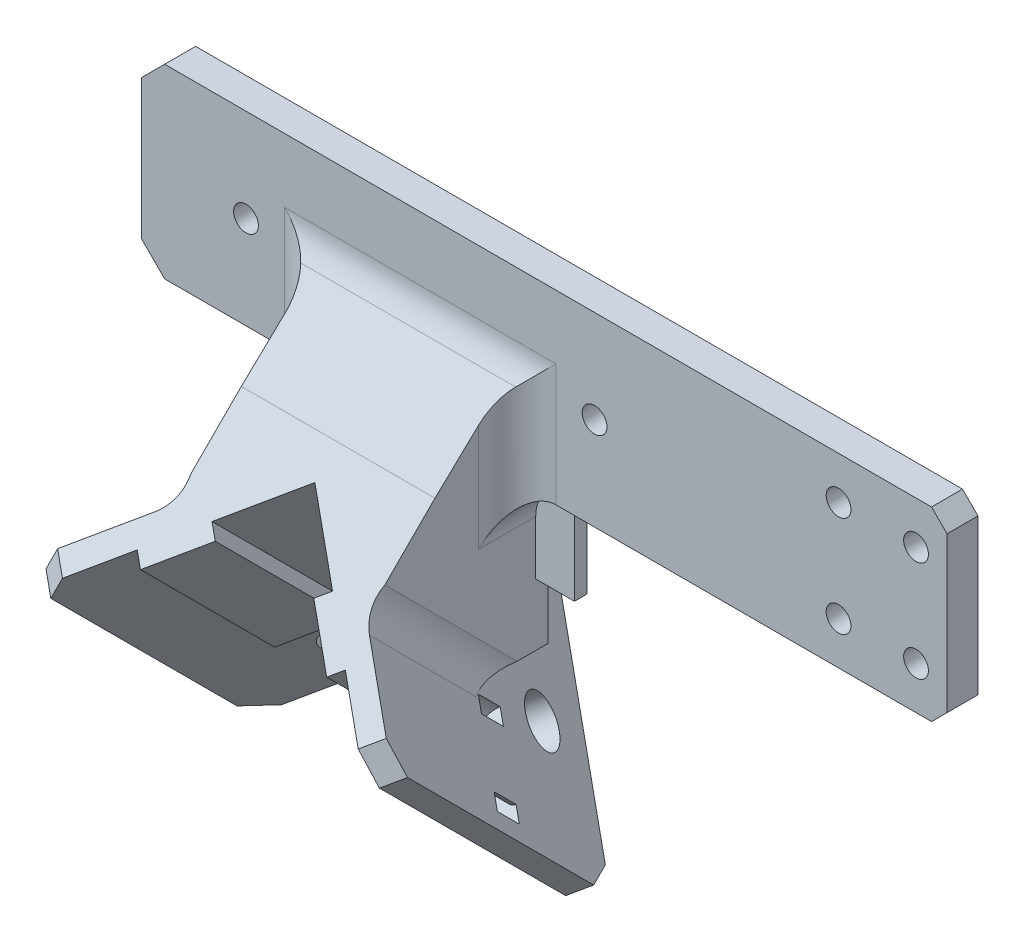
from build123d import *

# Parameters (mm, degrees)
CROQUIS1_R                   = 1.6
SALIENTE_EXTRUIR1_DEPTH      = 4
CROQUIS3_R                   = 1.6
SALIENTE_EXTRUIR3_DEPTH      = 4
SALIENTE_EXTRUIR4_DEPTH      = 10
SALIENTE_EXTRUIR4_DEPTH_BACK = 30
CORTAR_EXTRUIR8_REACH        = 97.414
CROQUIS13_R                  = 3.1
CORTAR_EXTRUIR9_DEPTH        = 2
CORTAR_EXTRUIR10_REACH       = 83.858
CROQUIS15_R                  = 3.1
CORTAR_EXTRUIR11_DEPTH       = 2
SALIENTE_EXTRUIR5_DEPTH      = 12.5
CORTAR_EXTRUIR12_DEPTH       = 95.018496218
REDONDEO1_R                  = 5
CHAFL_N1_SIZE                = 3
CROQUIS20_W                  = 35
CROQUIS20_H                  = 12
SALIENTE_EXTRUIR6_DEPTH      = 1.6
CORTAR_EXTRUIR13_START       = -16
CORTAR_EXTRUIR13_DEPTH       = 4


with BuildPart() as part:
    # Croquis1 → Saliente-Extruir1 (new body)
    with BuildSketch(Plane.XY):
        Polygon((12.5, -12), (36, -12), (36, 12), (-36, 12), (-36, -12), (-12.5, -12), (-12.5, -32), (12.5, -32), align=None)
        with Locations((-22.5, 0)):
            Circle(CROQUIS1_R, mode=Mode.SUBTRACT)
        with Locations(Location((22.5, 0, 0), (0, 0, 180))):
            Circle(CROQUIS1_R, mode=Mode.SUBTRACT)
    extrude(amount=SALIENTE_EXTRUIR1_DEPTH)

    # Croquis3 → Saliente-Extruir3 (add)
    with BuildSketch(Plane(origin=(0, 0, 0), x_dir=(-1, 0, 0), z_dir=(0, 0, -1))):
        Polygon((-66, 12), (-36, 12), (-36, -12), (-66, -12), (-68, -10), (-68, 10), align=None)
        with Locations((-54, 6.5)):
            Circle(CROQUIS3_R, mode=Mode.SUBTRACT)
        with Locations((-64, 6.5)):
            Circle(CROQUIS3_R, mode=Mode.SUBTRACT)
        with Locations(Location((-54, -6.5, 0), (0, 0, 180))):
            Circle(CROQUIS3_R, mode=Mode.SUBTRACT)
        with Locations(Location((-64, -6.5, 0), (0, 0, 180))):
            Circle(CROQUIS3_R, mode=Mode.SUBTRACT)
    extrude(amount=-SALIENTE_EXTRUIR3_DEPTH)

    # Croquis5 → Saliente-Extruir4 (add, two sides: drawn at the far end of the back side and taken through both)
    with BuildSketch(Plane(origin=(0, -4.201010127, -3.798989873), x_dir=(1, 0, 0), z_dir=(0, 0.7071067811865438, 0.7071067811865512)).offset(-SALIENTE_EXTRUIR4_DEPTH_BACK)):
        Polygon((-13.435028843, -33.707106781), (-21.213203436, -41.485281374), (-23.334523779, -39.363961031), (0, -16.029437252), (23.334523779, -39.363961031), (21.213203436, -41.485281374), (13.435028843, -33.707106781), (12.02081528, -35.121320344), (6.363961031, -29.464466094), (7.778174593, -28.050252532), (0, -20.272077939), (-7.778174593, -28.050252532), (-6.363961031, -29.464466094), (-12.02081528, -35.121320344), align=None)
    extrude(amount=SALIENTE_EXTRUIR4_DEPTH + SALIENTE_EXTRUIR4_DEPTH_BACK)

    # Croquis13 → Cortar-Extruir8 (cut, up to next)
    with BuildSketch(Plane(origin=(-11.692388155, -8.267766953, 8.267766953), x_dir=(0.40824829046385985, 0.2886751345948103, 0.866025403784441), z_dir=(-0.7071067811865496, -0.5000000000000013, 0.4999999999999959)), mode=Mode.PRIVATE) as cortar_extruir8_sk1:
        with Locations(Location((-5.529378483, -40.083354696, 0), (0, 0, 270))):
            Circle(CROQUIS13_R)
    cortar_extruir8_tool1 = extrude(cortar_extruir8_sk1.sketch, amount=-CORTAR_EXTRUIR8_REACH, mode=Mode.PRIVATE) & part.part
    add(cortar_extruir8_tool1.solids().sort_by_distance((9.192388, -42.591883, 3.479185))[0], mode=Mode.SUBTRACT)

    # Croquis14 → Cortar-Extruir9 (cut)
    with BuildSketch(Plane(origin=(-11.692388155, -8.267766953, 8.267766953), x_dir=(0.40824829046385985, 0.2886751345948103, 0.866025403784441), z_dir=(-0.7071067811865496, -0.5000000000000013, 0.4999999999999959))):
        Polygon((-11.513014174, -39.415444584), (-6.89421202, -45.947417231), (0.454257208, -40.751264808), (-4.164544945, -34.219292161), align=None)
    extrude(amount=-CORTAR_EXTRUIR9_DEPTH, mode=Mode.SUBTRACT)

    # Croquis15 → Cortar-Extruir10 (cut, up to next)
    with BuildSketch(Plane(origin=(8.62825877, -6.101100286, 14.767766953), x_dir=(0.6666666666666553, 0.23570226039552375, -0.7071067811865557), z_dir=(0.7071067811865587, -0.49999999999999484, 0.4999999999999895)), mode=Mode.PRIVATE) as cortar_extruir10_sk1:
        with Locations(Location((-12.499158228, -40.25364355, 0), (0, 0, 54.735610317))):
            Circle(CROQUIS15_R)
    cortar_extruir10_tool1 = extrude(cortar_extruir10_sk1.sketch, amount=-CORTAR_EXTRUIR10_REACH, mode=Mode.PRIVATE) & part.part
    add(cortar_extruir10_tool1.solids().sort_by_distance((-9.192388, -42.591883, 3.479185))[0], mode=Mode.SUBTRACT)

    # Croquis17 → Cortar-Extruir11 (cut)
    with BuildSketch(Plane(origin=(8.62825877, -6.101100286, 14.767766953), x_dir=(0.6666666666666595, 0.2357022603955385, -0.7071067811865467), z_dir=(0.7071067811865586, -0.4999999999999948, 0.49999999999998956))):
        Polygon((-14.770394394, -45.829617571), (-7.227922061, -43.162950904), (-10.227922061, -34.67766953), (-17.770394394, -37.344336196), align=None)
    extrude(amount=-CORTAR_EXTRUIR11_DEPTH, mode=Mode.SUBTRACT)

    # Croquis19 → Saliente-Extruir5 (add, symmetric)
    with BuildSketch(Plane(origin=(0, 0, 0), x_dir=(0, 0, -1), z_dir=(1, 0, 0))):
        Polygon((-14.606601718, -8.464466094), (-21.071067812, -14.928932188), (-4, -32), (-4, 1.6), align=None)
    extrude(amount=SALIENTE_EXTRUIR5_DEPTH, both=True)

    # Croquis18 → Cortar-Extruir12 (cut, through all)
    with BuildSketch(Plane(origin=(0, 3.071067812, 3.071067812), x_dir=(1, 0, 0), z_dir=(0, 0.7071067811865438, 0.7071067811865513))):
        Polygon((0, -20.556349186), (4.899494937, -25.455844123), (-4.899494937, -25.455844123), align=None)
    extrude(amount=-CORTAR_EXTRUIR12_DEPTH, mode=Mode.SUBTRACT)

    # Redondeo1
    # the kernel refuses this fillet: 5 mm, written as the material it adds along each edge
    with BuildSketch(Plane(origin=(12.5, -12, 4), x_dir=(1, 0, 0), z_dir=(0, 1, 0))) as redondeo1_piece_1_section:
        with BuildLine():
            CenterArc((REDONDEO1_R, -REDONDEO1_R), REDONDEO1_R, 90, 90)
            Line((0, -REDONDEO1_R), (0, 0))
            Line((0, 0), (REDONDEO1_R, 0))
        make_face()
    redondeo1_piece_1 = extrude(amount=26.1, mode=Mode.PRIVATE)
    redondeo1_piece_1 = split(redondeo1_piece_1, bisect_by=Plane(origin=(12.5, -4.843560917, 10.790651749), z_dir=(0, -0.7254024787176051, -0.6883249551413595)), keep=Keep.TOP, mode=Mode.PRIVATE)
    add(redondeo1_piece_1)
    with BuildSketch(Plane(origin=(-12.5, -12, 4), x_dir=(0, 0, 1), z_dir=(0, 1, 0))) as redondeo1_piece_2_section:
        with BuildLine():
            CenterArc((REDONDEO1_R, -REDONDEO1_R), REDONDEO1_R, 90, 90)
            Line((0, -REDONDEO1_R), (0, 0))
            Line((0, 0), (REDONDEO1_R, 0))
        make_face()
    redondeo1_piece_2 = extrude(amount=26.1, mode=Mode.PRIVATE)
    redondeo1_piece_2 = split(redondeo1_piece_2, bisect_by=Plane(origin=(-12.5, -4.843560917, 10.790651749), z_dir=(0, -0.7254024787176051, -0.6883249551413595)), keep=Keep.TOP, mode=Mode.PRIVATE)
    add(redondeo1_piece_2)
    with BuildSketch(Plane(origin=(9.142135624, -14.928932188, 21.071067812), x_dir=(1, 0, 0), z_dir=(5.181305113656439e-15, -0.7071067811865475, -0.7071067811865476))) as redondeo1_piece_3_section:
        with BuildLine():
            CenterArc((8.223291456, 1.152223645), REDONDEO1_R, 135, 58.323256203)
            Line((4.687757551, 4.687757551), (0, 0))
            Line((0, 0), (3.357864376, 0))
        make_face()
    redondeo1_piece_3 = extrude(amount=40.715861386, mode=Mode.PRIVATE)
    redondeo1_piece_3 = split(redondeo1_piece_3, bisect_by=Plane(origin=(9.142135624, -32, 21.071067812), z_dir=(0, 1, 0)), keep=Keep.TOP, mode=Mode.PRIVATE)
    add(redondeo1_piece_3)
    with BuildSketch(Plane(origin=(-9.142135624, -43.719393876, -7.719393876), x_dir=(-1, 0, 0), z_dir=(5.181305113656437e-15, 0.7071067811865476, 0.7071067811865476))) as redondeo1_piece_4_section:
        with BuildLine():
            CenterArc((8.223291456, 1.152223645), REDONDEO1_R, 135, 58.323256203)
            Line((4.687757551, 4.687757551), (0, 0))
            Line((0, 0), (3.357864376, 0))
        make_face()
    redondeo1_piece_4 = extrude(amount=40.715861386, mode=Mode.PRIVATE)
    redondeo1_piece_4 = split(redondeo1_piece_4, bisect_by=Plane(origin=(-9.142135624, -32, -7.719393876), z_dir=(0, 1, 0)), keep=Keep.TOP, mode=Mode.PRIVATE)
    add(redondeo1_piece_4)
    with BuildSketch(Plane(origin=(-12.5, -12, 0), x_dir=(-1, 0, 0), z_dir=(0, 0, 1))) as redondeo1_piece_5:
        with BuildLine():
            CenterArc((REDONDEO1_R, REDONDEO1_R), REDONDEO1_R, 180, 90)
            Line((0, REDONDEO1_R), (0, 0))
            Line((0, 0), (REDONDEO1_R, 0))
        make_face()
    extrude(amount=4)
    with BuildSketch(Plane(origin=(12.5, -12, 0), x_dir=(1, 0, 0), z_dir=(0, 0, 1))) as redondeo1_piece_6:
        with BuildLine():
            CenterArc((REDONDEO1_R, -REDONDEO1_R), REDONDEO1_R, 90, 90)
            Line((0, -REDONDEO1_R), (0, 0))
            Line((0, 0), (REDONDEO1_R, 0))
        make_face()
    extrude(amount=4)
    with BuildSketch(Plane(origin=(12.5, 1.6, 4), x_dir=(0, -0.6883249551413598, 0.725402478717605), z_dir=(-1, 0, 0))) as redondeo1_piece_7:
        with BuildLine():
            CenterArc((REDONDEO1_R * 0.429658091891, REDONDEO1_R), REDONDEO1_R, 223.497660381, 46.502339619)
            Line((-REDONDEO1_R * 0.295744386827, REDONDEO1_R * 0.311675044859), (0, 0))
            Line((0, 0), (REDONDEO1_R * 0.429658091891, 0))
        make_face()
    extrude(amount=25)
    with BuildSketch(Plane(origin=(12.5, -12, 0), x_dir=(1, 0, 0), z_dir=(0, 0, 1))) as redondeo1_piece_8a_section:
        with BuildLine():
            CenterArc((REDONDEO1_R, -REDONDEO1_R), REDONDEO1_R, 90, 90)
            Line((0, -REDONDEO1_R), (0, 0))
            Line((0, 0), (REDONDEO1_R, 0))
        make_face()
    redondeo1_piece_8a = extrude(amount=16.5, mode=Mode.PRIVATE)
    redondeo1_piece_8a = split(redondeo1_piece_8a, bisect_by=Plane(origin=(12.5, -12, 4), z_dir=(0, 0, 1)), keep=Keep.TOP, mode=Mode.PRIVATE)
    with BuildSketch(Plane(origin=(12.5, -24.5, 4), x_dir=(1, 0, 0), z_dir=(0, 1, 0))) as redondeo1_piece_8b_section:
        with BuildLine():
            CenterArc((REDONDEO1_R, -REDONDEO1_R), REDONDEO1_R, 90, 90)
            Line((0, -REDONDEO1_R), (0, 0))
            Line((0, 0), (REDONDEO1_R, 0))
        make_face()
    redondeo1_piece_8b = extrude(amount=38.6, mode=Mode.PRIVATE)
    redondeo1_piece_8b = split(redondeo1_piece_8b, bisect_by=Plane(origin=(12.5, -12, 4), z_dir=(0, -1, 0)), keep=Keep.TOP, mode=Mode.PRIVATE)
    redondeo1_piece_8 = redondeo1_piece_8a & redondeo1_piece_8b
    add(redondeo1_piece_8)
    with BuildSketch(Plane(origin=(17.870726149, 1.6, 4), x_dir=(0, -0.6883249551413598, 0.725402478717605), z_dir=(-1, 0, 0))) as redondeo1_piece_9a_section:
        with BuildLine():
            CenterArc((REDONDEO1_R * 0.429658091891, REDONDEO1_R), REDONDEO1_R, 223.497660381, 46.502339619)
            Line((-REDONDEO1_R * 0.295744386827, REDONDEO1_R * 0.311675044859), (0, 0))
            Line((0, 0), (REDONDEO1_R * 0.429658091891, 0))
        make_face()
    redondeo1_piece_9a = extrude(amount=30.370726149, mode=Mode.PRIVATE)
    redondeo1_piece_9a = split(redondeo1_piece_9a, bisect_by=Plane(origin=(12.5, 1.6, 4), z_dir=(1, 0, 0)), keep=Keep.TOP, mode=Mode.PRIVATE)
    with BuildSketch(Plane(origin=(12.5, -12, 4), x_dir=(1, 0, 0), z_dir=(0, 1, 0))) as redondeo1_piece_9b_section:
        with BuildLine():
            CenterArc((REDONDEO1_R, -REDONDEO1_R), REDONDEO1_R, 90, 90)
            Line((0, -REDONDEO1_R), (0, 0))
            Line((0, 0), (REDONDEO1_R, 0))
        make_face()
    redondeo1_piece_9b = extrude(amount=26.1, mode=Mode.PRIVATE)
    redondeo1_piece_9b = split(redondeo1_piece_9b, bisect_by=Plane(origin=(12.5, 12, 4), z_dir=(0, -1, 0)), keep=Keep.TOP, mode=Mode.PRIVATE)
    redondeo1_piece_9b = split(redondeo1_piece_9b, bisect_by=Plane(origin=(12.5, -4.843560917, 10.790651749), z_dir=(0, 0.7254024787176051, 0.6883249551413595)), keep=Keep.TOP, mode=Mode.PRIVATE)
    redondeo1_piece_9 = redondeo1_piece_9a & redondeo1_piece_9b
    add(redondeo1_piece_9)
    with BuildSketch(Plane(origin=(-12.5, -12, 0), x_dir=(-1, 0, 0), z_dir=(0, 0, 1))) as redondeo1_piece_10a_section:
        with BuildLine():
            CenterArc((REDONDEO1_R, REDONDEO1_R), REDONDEO1_R, 180, 90)
            Line((0, REDONDEO1_R), (0, 0))
            Line((0, 0), (REDONDEO1_R, 0))
        make_face()
    redondeo1_piece_10a = extrude(amount=16.5, mode=Mode.PRIVATE)
    redondeo1_piece_10a = split(redondeo1_piece_10a, bisect_by=Plane(origin=(-12.5, -12, 4), z_dir=(0, 0, 1)), keep=Keep.TOP, mode=Mode.PRIVATE)
    with BuildSketch(Plane(origin=(-12.5, -24.5, 4), x_dir=(0, 0, 1), z_dir=(0, 1, 0))) as redondeo1_piece_10b_section:
        with BuildLine():
            CenterArc((REDONDEO1_R, -REDONDEO1_R), REDONDEO1_R, 90, 90)
            Line((0, -REDONDEO1_R), (0, 0))
            Line((0, 0), (REDONDEO1_R, 0))
        make_face()
    redondeo1_piece_10b = extrude(amount=38.6, mode=Mode.PRIVATE)
    redondeo1_piece_10b = split(redondeo1_piece_10b, bisect_by=Plane(origin=(-12.5, -12, 4), z_dir=(0, -1, 0)), keep=Keep.TOP, mode=Mode.PRIVATE)
    redondeo1_piece_10 = redondeo1_piece_10a & redondeo1_piece_10b
    add(redondeo1_piece_10)
    with BuildSketch(Plane(origin=(-12.5, -12, 4), x_dir=(0, 0, 1), z_dir=(0, 1, 0))) as redondeo1_piece_11a_section:
        with BuildLine():
            CenterArc((REDONDEO1_R, -REDONDEO1_R), REDONDEO1_R, 90, 90)
            Line((0, -REDONDEO1_R), (0, 0))
            Line((0, 0), (REDONDEO1_R, 0))
        make_face()
    redondeo1_piece_11a = extrude(amount=26.1, mode=Mode.PRIVATE)
    redondeo1_piece_11a = split(redondeo1_piece_11a, bisect_by=Plane(origin=(-12.5, 12, 4), z_dir=(0, -1, 0)), keep=Keep.TOP, mode=Mode.PRIVATE)
    redondeo1_piece_11a = split(redondeo1_piece_11a, bisect_by=Plane(origin=(-12.5, -4.843560917, 10.790651749), z_dir=(0, 0.7254024787176051, 0.6883249551413595)), keep=Keep.TOP, mode=Mode.PRIVATE)
    with BuildSketch(Plane(origin=(12.5, 1.6, 4), x_dir=(0, -0.6883249551413598, 0.725402478717605), z_dir=(-1, 0, 0))) as redondeo1_piece_11b_section:
        with BuildLine():
            CenterArc((REDONDEO1_R * 0.429658091891, REDONDEO1_R), REDONDEO1_R, 223.497660381, 46.502339619)
            Line((-REDONDEO1_R * 0.295744386827, REDONDEO1_R * 0.311675044859), (0, 0))
            Line((0, 0), (REDONDEO1_R * 0.429658091891, 0))
        make_face()
    redondeo1_piece_11b = extrude(amount=30.370726149, mode=Mode.PRIVATE)
    redondeo1_piece_11b = split(redondeo1_piece_11b, bisect_by=Plane(origin=(-12.5, 1.6, 4), z_dir=(-1, 0, 0)), keep=Keep.TOP, mode=Mode.PRIVATE)
    redondeo1_piece_11 = redondeo1_piece_11a & redondeo1_piece_11b
    add(redondeo1_piece_11)

    # Chaflán1
    # the kernel refuses this chamfer: 3 mm, written as the material it takes off along each edge
    with BuildSketch(Plane(origin=(28.789887219, -49.39121286, -1.035194012), x_dir=(-0.7071067811865446, 0.500000000000004, -0.5000000000000001), z_dir=(-0.7071067811865506, -0.5000000000000006, 0.4999999999999953))) as chafl_n1_piece_1:
        Polygon((CHAFL_N1_SIZE, 0), (0, -CHAFL_N1_SIZE), (0, 0), align=None)
    extrude(amount=18.430097928, mode=Mode.SUBTRACT)
    with BuildSketch(Plane(origin=(28.789887219, -21.106941612, 27.249077236), x_dir=(-0.7071067811865446, 0.5000000000000879, -0.49999999999991623), z_dir=(-0.7071067811865506, -0.5000000000000006, 0.4999999999999953)), Plane(origin=(-15.757839996, -58.606261823, 8.179854952), x_dir=(0, 0.707106781186544, 0.7071067811865511), z_dir=(-0.7071067811865535, 0.4999999999999984, -0.49999999999999317)), Plane(origin=(-15.757839996, -30.321990576, 36.4641262), x_dir=(0.7071067811865416, 0.50000000000009, -0.49999999999991834), z_dir=(-0.7071067811865535, 0.4999999999999984, -0.49999999999999317))) as chafl_n1_piece_2:
        Polygon((CHAFL_N1_SIZE, 0), (0, CHAFL_N1_SIZE), (0, 0), align=None)
    extrude(amount=18.430097928, mode=Mode.SUBTRACT)
    with BuildSketch(Plane(origin=(-36, -12, -7.715048964), x_dir=(0, 1, 0), z_dir=(0, 0, 1)), Plane(origin=(-36, 12, -7.715048964), x_dir=(1, 0, 0), z_dir=(0, 0, 1))) as chafl_n1_piece_3:
        Polygon((CHAFL_N1_SIZE, 0), (0, -CHAFL_N1_SIZE), (0, 0), align=None)
    extrude(amount=19.430097928, mode=Mode.SUBTRACT)
    with BuildSketch(Plane(origin=(17.47617872, -45.267427059, 12.518689717), x_dir=(0.7071067811865496, 0.5000000000000003, -0.49999999999999684), z_dir=(-0.7071067811865456, 0.5000000000000039, -0.49999999999999906))) as chafl_n1_piece_4_section:
        Polygon((CHAFL_N1_SIZE, 0), (0, -CHAFL_N1_SIZE), (0, 0), align=None)
    chafl_n1_piece_4 = extrude(amount=23.430097928, mode=Mode.PRIVATE)
    chafl_n1_piece_4 = split(chafl_n1_piece_4, bisect_by=Plane(origin=(18.890392282, -44.267427059, 11.518689717), z_dir=(-0.7071067811865606, -0.49999999999999345, 0.4999999999999882)), keep=Keep.TOP, mode=Mode.PRIVATE)
    add(chafl_n1_piece_4, mode=Mode.SUBTRACT)
    with BuildSketch(Plane(origin=(-0.908597591, -33.552378095, 0.803640753), x_dir=(-0.7071067811865586, 0.49999999999999445, -0.49999999999999), z_dir=(-0.7071067811865365, -0.5000000000000099, 0.5000000000000058))) as chafl_n1_piece_5_section:
        Polygon((CHAFL_N1_SIZE, 0), (0, -CHAFL_N1_SIZE), (0, 0), align=None)
    chafl_n1_piece_5 = extrude(amount=23.430097928, mode=Mode.PRIVATE)
    chafl_n1_piece_5 = split(chafl_n1_piece_5, bisect_by=Plane(origin=(-2.322811153, -32.552378095, -0.196359247), z_dir=(0.7071067811865478, -0.5000000000000027, 0.4999999999999969)), keep=Keep.TOP, mode=Mode.PRIVATE)
    add(chafl_n1_piece_5, mode=Mode.SUBTRACT)
    with BuildSketch(Plane(origin=(-17.47617872, -51.631388089, 6.154728686), x_dir=(-0.7071067811865586, 0.49999999999999495, -0.49999999999998934), z_dir=(0.7071067811865365, 0.5000000000000046, -0.5000000000000111))) as chafl_n1_piece_6_section:
        Polygon((CHAFL_N1_SIZE, 0), (0, -CHAFL_N1_SIZE), (0, 0), align=None)
    chafl_n1_piece_6 = extrude(amount=23.430097928, mode=Mode.PRIVATE)
    chafl_n1_piece_6 = split(chafl_n1_piece_6, bisect_by=Plane(origin=(-18.890392282, -50.631388089, 5.154728686), z_dir=(0.7071067811865478, -0.5000000000000027, 0.4999999999999969)), keep=Keep.TOP, mode=Mode.PRIVATE)
    add(chafl_n1_piece_6, mode=Mode.SUBTRACT)
    with BuildSketch(Plane(origin=(0.908597591, -39.916339125, -5.560320277), x_dir=(0.7071067811865496, 0.5000000000000003, -0.4999999999999967), z_dir=(0.7071067811865456, -0.5000000000000033, 0.49999999999999967))) as chafl_n1_piece_7_section:
        Polygon((CHAFL_N1_SIZE, 0), (0, -CHAFL_N1_SIZE), (0, 0), align=None)
    chafl_n1_piece_7 = extrude(amount=23.430097928, mode=Mode.PRIVATE)
    chafl_n1_piece_7 = split(chafl_n1_piece_7, bisect_by=Plane(origin=(2.322811153, -38.916339125, -6.560320277), z_dir=(-0.7071067811865606, -0.49999999999999345, 0.4999999999999882)), keep=Keep.TOP, mode=Mode.PRIVATE)
    add(chafl_n1_piece_7, mode=Mode.SUBTRACT)

    # Croquis20 → Saliente-Extruir6 (add)
    with BuildSketch(Plane(origin=(0, 0, 0), x_dir=(-1, 0, 0), z_dir=(0, 0, -1))):
        with Locations((0, -18)):
            Rectangle(CROQUIS20_W, CROQUIS20_H)
    extrude(amount=-SALIENTE_EXTRUIR6_DEPTH)

    # Croquis23 → Cortar-Extruir13 (cut)
    with BuildSketch(Plane(origin=(0, -25.213203436, -25.213203436), x_dir=(1, 0, 0), z_dir=(0, -0.7071067811865437, -0.7071067811865513)).offset(CORTAR_EXTRUIR13_START)):
        with BuildLine():
            Line((14.919953083, 32.647875144), (19.091883092, 36.819805153))
            ThreePointArc((19.091883092, 36.819805153), (19.798989873, 37.112698372), (20.506096654, 36.819805153))
            Line((20.506096654, 36.819805153), (21.920310217, 38.234018716))
            ThreePointArc((21.920310217, 38.234018716), (19.798989873, 39.112698372), (17.67766953, 38.234018716))
            Line((17.67766953, 38.234018716), (13.505739521, 34.062088707))
            ThreePointArc((13.505739521, 34.062088707), (12.627059864, 31.940768363), (13.505739521, 29.81944802))
            Line((13.505739521, 29.81944802), (14.919953083, 31.233661582))
            ThreePointArc((14.919953083, 31.233661582), (14.627059864, 31.940768363), (14.919953083, 32.647875144))
        make_face()
    extrude(amount=-CORTAR_EXTRUIR13_DEPTH, mode=Mode.SUBTRACT)


solid = part.part
